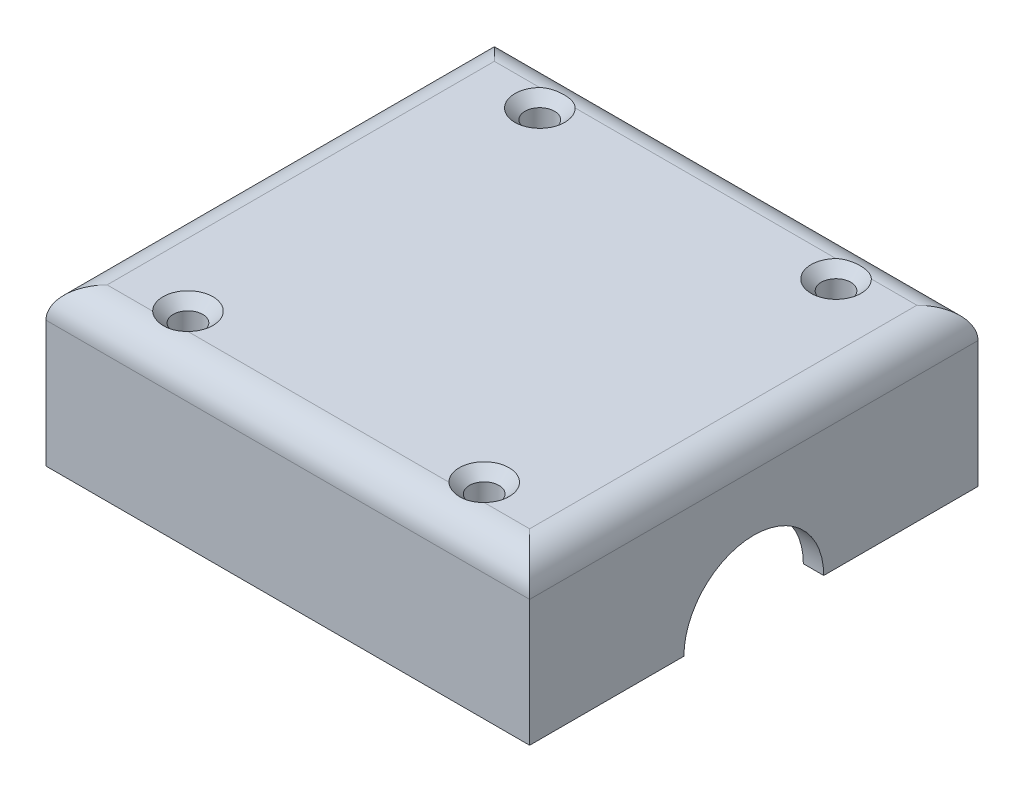
from build123d import *

# Parameters (mm, degrees)
SKETCH1_W           = 47.46
SKETCH1_H           = 44
BOSS_EXTRUDE1_DEPTH = 15.4
SKETCH2_W           = 21.6
SKETCH2_H           = 21.82
CUT_EXTRUDE1_DEPTH  = 10.91
FILLET1_R           = 10.91
SKETCH4_W           = 23.86
SKETCH4_H           = 20.2
CUT_EXTRUDE2_DEPTH  = 7.65
SKETCH8_R           = 1.45
CUT_EXTRUDE3_DEPTH  = 20.18
CHAMFER1_SIZE       = 1
FILLET2_R           = 3
SKETCH9_R           = 6.86
CUT_EXTRUDE4_DEPTH  = 2.18
BOSS_EXTRUDE3_DEPTH = 23.86


# Some blends are built 0.0001 mm under size
with BuildPart() as part:
    # Sketch1 → Boss-Extrude1 (new body)
    with BuildSketch(Plane(origin=(0, 0, 0), x_dir=(1, 0, 0), z_dir=(0, 1, 0))):
        Rectangle(SKETCH1_W, SKETCH1_H)
    extrude(amount=BOSS_EXTRUDE1_DEPTH)

    # Sketch2 → Cut-Extrude1 (cut)
    with BuildSketch(Plane.XZ):
        with Locations((10.93, 0)):
            Rectangle(SKETCH2_W, SKETCH2_H)
    extrude(amount=-CUT_EXTRUDE1_DEPTH, mode=Mode.SUBTRACT)

    # Fillet1
    fillet1_edges = [part.edges().sort_by_distance(p)[0] for p in [
        (10.93, 10.91, -10.91),
        (10.93, 10.91, 10.91),
    ]]
    fillet(fillet1_edges, radius=FILLET1_R - 0.0001)  # a hair under: the kernel refuses the full size

    # Sketch4 → Cut-Extrude2 (cut)
    with BuildSketch(Plane.XZ):
        with Locations((-11.8, 0)):
            Rectangle(SKETCH4_W, SKETCH4_H)
    extrude(amount=-CUT_EXTRUDE2_DEPTH, mode=Mode.SUBTRACT)

    # Sketch8 → Cut-Extrude3 (cut)
    with BuildSketch(Plane.XZ):
        with Locations(Location((14.535, -17.265, 0), (0, 0, 270))):
            Circle(SKETCH8_R)
        with Locations(Location((-14.535, -17.265, 0), (0, 0, 270))):
            Circle(SKETCH8_R)
    cut_extrude3 = extrude(amount=-CUT_EXTRUDE3_DEPTH, mode=Mode.SUBTRACT)

    # Mirror1: Cut-Extrude3 across plane
    add(cut_extrude3.mirror(Plane(origin=(0, 0, 0), x_dir=(1, 0, 0), z_dir=(0, 0, -1))), mode=Mode.SUBTRACT)

    # Chamfer1
    chamfer1_edges = [part.edges().sort_by_distance(p)[0] for p in [
        (14.535, 15.4, -15.815),
        (-14.535, 15.4, -15.815),
        (14.535, 15.4, 15.815),
        (-14.535, 15.4, 15.815),
    ]]
    chamfer(chamfer1_edges, length=CHAMFER1_SIZE)

    # Fillet2
    # the kernel refuses this fillet: 3 mm, written as the material it takes off along each edge
    with BuildSketch(Plane(origin=(23.73, 15.4, 29.5), x_dir=(-1, 0, 0), z_dir=(0, 0, -1)), Plane(origin=(-23.73, 15.4, -29.5), x_dir=(1, 0, 0), z_dir=(0, 0, 1))) as fillet2_piece_1:
        with BuildLine():
            CenterArc((FILLET2_R, -FILLET2_R), FILLET2_R, 90, 90)
            Line((0, -FILLET2_R), (0, 0))
            Line((0, 0), (FILLET2_R, 0))
        make_face()
    extrude(amount=59, mode=Mode.SUBTRACT)
    with BuildSketch(Plane(origin=(31.23, 15.4, -22), x_dir=(0, 0, 1), z_dir=(-1, 0, 0)), Plane(origin=(-31.23, 15.4, 22), x_dir=(0, 0, -1), z_dir=(1, 0, 0))) as fillet2_piece_2:
        with BuildLine():
            CenterArc((FILLET2_R, -FILLET2_R), FILLET2_R, 90, 90)
            Line((0, -FILLET2_R), (0, 0))
            Line((0, 0), (FILLET2_R, 0))
        make_face()
    extrude(amount=62.46, mode=Mode.SUBTRACT)

    # Sketch9 → Cut-Extrude4 (cut)
    with BuildSketch(Plane(origin=(23.73, 0, 0), x_dir=(0, 0, -1), z_dir=(1, 0, 0))):
        Circle(SKETCH9_R)
    extrude(amount=-CUT_EXTRUDE4_DEPTH, mode=Mode.SUBTRACT)

    # Sketch10 → Boss-Extrude3 (add)
    with BuildSketch(Plane.ZY.offset(23.73)):
        with BuildLine():
            Line((-7.65, 7.65), (-10.1, 7.65))
            Line((-10.1, 7.65), (-10.1, 1.997052779))
            ThreePointArc((-10.1, 1.997052779), (-9.316559187, 5.014899131), (-7.65, 7.65))
        make_face()
        with BuildLine():
            Line((10.1, 1.997052779), (10.1, 7.65))
            Line((10.1, 7.65), (7.65, 7.65))
            ThreePointArc((7.65, 7.65), (9.316559187, 5.014899131), (10.1, 1.997052779))
        make_face()
    extrude(amount=-BOSS_EXTRUDE3_DEPTH)


solid = part.part
